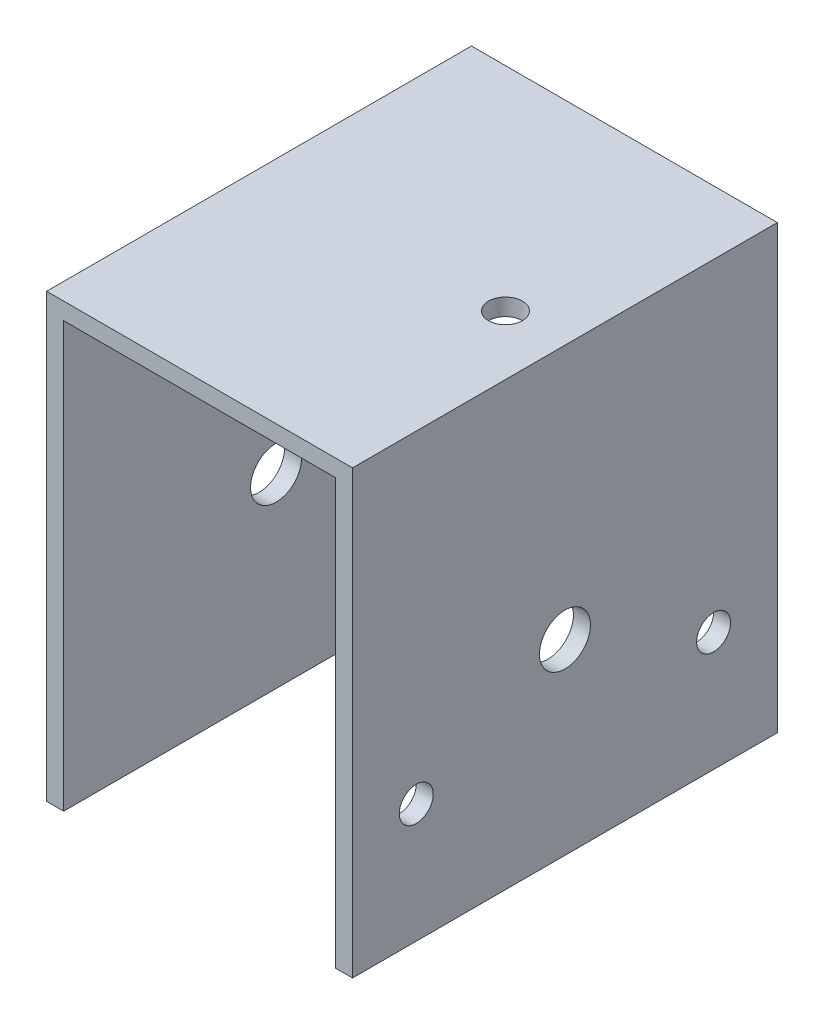
from build123d import *

# Parameters (mm, degrees)
SKETCH2_W           = 32
SKETCH2_H           = 50
SKETCH2_R           = 2
BOSS_EXTRUDE1_DEPTH = 2
SKETCH4_R           = 3
BOSS_EXTRUDE2_DEPTH = 2
BOSS_EXTRUDE3_START = 2
SKETCH3_R           = 3
SKETCH3_R_2         = 2
BOSS_EXTRUDE3_DEPTH = 2


with BuildPart() as part:
    # Sketch2 → Boss-Extrude1 (new body)
    with BuildSketch(Plane(origin=(0, 0, 0), x_dir=(1, 0, 0), z_dir=(0, 1, 0))):
        with Locations((-11, 0)):
            Rectangle(SKETCH2_W, SKETCH2_H)
        Circle(SKETCH2_R, mode=Mode.SUBTRACT)
    extrude(amount=BOSS_EXTRUDE1_DEPTH)

    # Sketch4 → Boss-Extrude2 (add)
    with BuildSketch(Plane.ZY.offset(27)):
        Polygon((-25, -6.432485609), (-25, 2), (25, 2), (25, -50), (-25, -50), align=None)
        with Locations((0, -28)):
            Circle(SKETCH4_R, mode=Mode.SUBTRACT)
    extrude(amount=BOSS_EXTRUDE2_DEPTH)

    # Sketch3 → Boss-Extrude3 (add)
    with BuildSketch(Plane(origin=(5, 0, 0), x_dir=(0, 0, -1), z_dir=(1, 0, 0)).offset(BOSS_EXTRUDE3_START)):
        Polygon((25, 0), (25, 2), (-25, 2), (-25, -50), (25, -50), align=None)
        with Locations((0, -28)):
            Circle(SKETCH3_R, mode=Mode.SUBTRACT)
        with Locations((-17.5, -36)):
            Circle(SKETCH3_R_2, mode=Mode.SUBTRACT)
        with Locations((17.5, -36)):
            Circle(SKETCH3_R_2, mode=Mode.SUBTRACT)
    extrude(amount=-BOSS_EXTRUDE3_DEPTH)


solid = part.part
